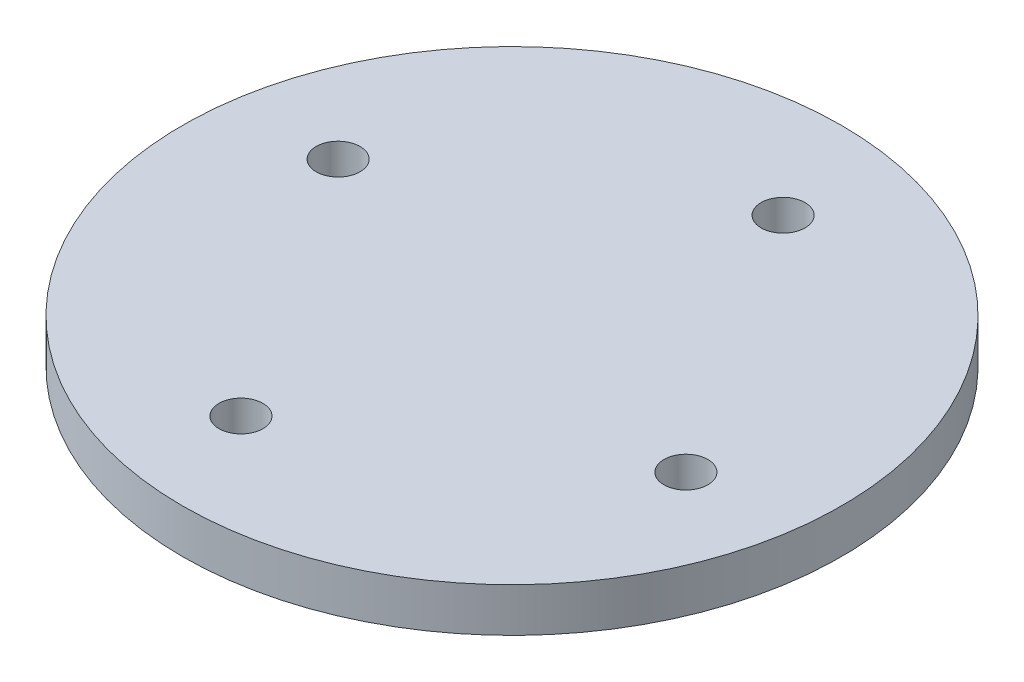
from build123d import *

# Parameters (mm, degrees)
SKETCH1_R           = 15
SKETCH1_R_2         = 1
BOSS_EXTRUDE1_DEPTH = 2


with BuildPart() as part:
    # Sketch1 → Boss-Extrude1 (new body)
    with BuildSketch(Plane(origin=(0, 0, 0), x_dir=(1, 0, 0), z_dir=(0, 1, 0))):
        Circle(SKETCH1_R)
        with Locations((2.211637479, 10.12629669)):
            Circle(SKETCH1_R_2, mode=Mode.SUBTRACT)
        with Locations((-10.12629669, 2.211637479)):
            Circle(SKETCH1_R_2, mode=Mode.SUBTRACT)
        with Locations((-2.211637479, -10.12629669)):
            Circle(SKETCH1_R_2, mode=Mode.SUBTRACT)
        with Locations((10.12629669, -2.211637479)):
            Circle(SKETCH1_R_2, mode=Mode.SUBTRACT)
    extrude(amount=BOSS_EXTRUDE1_DEPTH)


solid = part.part
